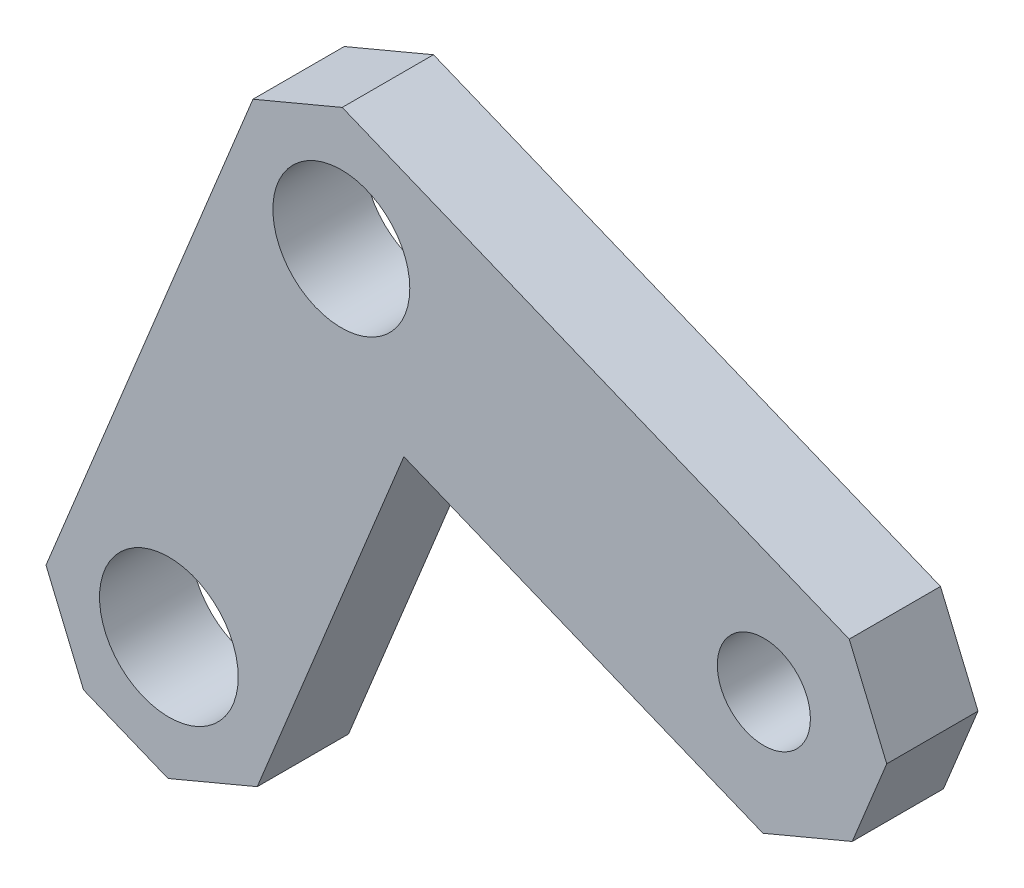
from build123d import *

# Parameters (mm, degrees)
SKETCH_1_R      = 5.1
SKETCH_1_R_2    = 7.5
SKETCH_1_R_3    = 7.6
EXTRUDE_1_DEPTH = 10
CHAMFER_1_SIZE  = 7.5


with BuildPart() as part:
    # 草圖1 → 填料-伸長1 (new body)
    with BuildSketch(Plane.XY):
        Polygon((-42.684704159, 14.950876454), (26.753169389, -13.39311263), (17.305173028, -36.539070479), (-28.986742671, -17.643077757), (-47.882735393, -63.934993455), (-71.028693242, -54.486997094), align=None)
        with Locations((10.456192284, -20.242093374)):
            Circle(SKETCH_1_R, mode=Mode.SUBTRACT)
        with Locations((-35.835723415, -1.346100652)):
            Circle(SKETCH_1_R_2, mode=Mode.SUBTRACT)
        with Locations((-54.731716137, -47.63801635)):
            Circle(SKETCH_1_R_3, mode=Mode.SUBTRACT)
    extrude(amount=-EXTRUDE_1_DEPTH)

    # 導角1
    chamfer_1_edges = [part.edges().sort_by_distance(p)[0] for p in [
        (-47.882735393, -63.934993455, -5),
        (17.305173028, -36.539070479, -5),
        (26.753169389, -13.39311263, -5),
        (-71.028693242, -54.486997094, -5),
        (-42.684704159, 14.950876454, -5),
    ]]
    chamfer(chamfer_1_edges, length=CHAMFER_1_SIZE)


solid = part.part
